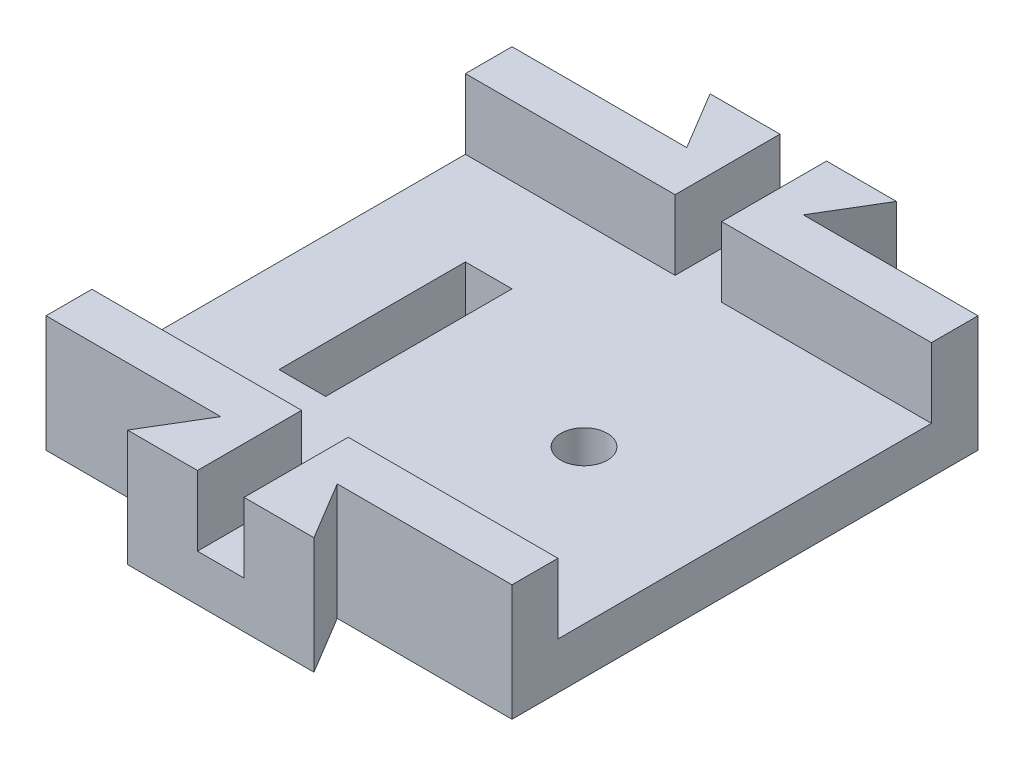
from build123d import *

# Parameters (mm, degrees)
SKETCH1_W           = 200
SKETCH1_H           = 200
SKETCH1_W_2         = 20
SKETCH1_H_2         = 80
BOSS_EXTRUDE1_DEPTH = 50
SHELL1_START        = 20.678946788
SHELL1_OUTLINE_W    = 30
SHELL1_OUTLINE_H    = 160
SHELL1_DEPTH        = 100
SHELL1_START_2      = -39.321053212
SHELL1_2_OUTLINE_W  = 30
SHELL1_2_OUTLINE_H  = 20
SHELL1_2_DEPTH      = 60
SKETCH4_W           = 60
SKETCH4_H           = 120
CUT_EXTRUDE1_DEPTH  = 30
BOSS_EXTRUDE2_DEPTH = 50
SKETCH6_W           = 20
SKETCH6_H           = 45
CUT_EXTRUDE2_DEPTH  = 30
SKETCH7_R           = 10
CUT_EXTRUDE3_DEPTH  = 28
SKETCH8_W           = 160.292931591
SKETCH8_H           = 30
CUT_EXTRUDE4_DEPTH  = 213


# Read off the part's stored shape, not the designer's step: Shell1
with BuildPart() as part:
    # Sketch1 → Boss-Extrude1 (new body)
    with BuildSketch(Plane(origin=(0, 0, 0), x_dir=(1, 0, 0), z_dir=(0, 1, 0))):
        with Locations((40.678946788, 74.932071062)):
            Rectangle(SKETCH1_W, SKETCH1_H)
        with Locations((-9.321053212, 74.932071062)):
            Rectangle(SKETCH1_W_2, SKETCH1_H_2, mode=Mode.SUBTRACT)
    extrude(amount=BOSS_EXTRUDE1_DEPTH)

    # Shell1 outline → Shell1 (cut)
    with BuildSketch(Plane.YZ.offset(SHELL1_START)):
        with Locations((35, -74.932071062)):
            Rectangle(SHELL1_OUTLINE_W, SHELL1_OUTLINE_H)
    extrude(amount=SHELL1_DEPTH, mode=Mode.SUBTRACT)

    # Shell1 2 outline → Shell1 2 (cut)
    with BuildSketch(Plane.YZ.offset(SHELL1_START_2)):
        with Locations((35, -144.932071062)):
            Rectangle(SHELL1_2_OUTLINE_W, SHELL1_2_OUTLINE_H)
        with Locations((35, -4.932071062)):
            Rectangle(SHELL1_2_OUTLINE_W, SHELL1_2_OUTLINE_H)
    extrude(amount=SHELL1_2_DEPTH, mode=Mode.SUBTRACT)

    # Sketch4 → Cut-Extrude1 (cut)
    with BuildSketch(Plane(origin=(0, 50, 0), x_dir=(1, 0, 0), z_dir=(0, 1, 0))):
        with Locations((-9.321053212, 74.932071062)):
            Rectangle(SKETCH4_W, SKETCH4_H)
    extrude(amount=-CUT_EXTRUDE1_DEPTH, mode=Mode.SUBTRACT)

    # Sketch5 → Boss-Extrude2 (add)
    with BuildSketch(Plane.XZ):
        Polygon((40.678946788, 25.067928938), (15.678946788, 25.067928938), (0.678946788, 50.067928938), (80.678946788, 50.067928938), (65.678946788, 25.067928938), align=None)
    boss_extrude2 = extrude(amount=-BOSS_EXTRUDE2_DEPTH)

    # Sketch6 → Cut-Extrude2 (cut)
    with BuildSketch(Plane(origin=(0, 50, 0), x_dir=(1, 0, 0), z_dir=(0, 1, 0))):
        with Locations((40.678946788, -27.567928938)):
            Rectangle(SKETCH6_W, SKETCH6_H)
    cut_extrude2 = extrude(amount=-CUT_EXTRUDE2_DEPTH, mode=Mode.SUBTRACT)

    # Mirror1: Boss-Extrude2, Cut-Extrude2 across plane
    add(boss_extrude2.mirror(Plane.XY.offset(-74.932071062)))
    add(cut_extrude2.mirror(Plane.XY.offset(-74.932071062)), mode=Mode.SUBTRACT)

    # Sketch7 → Cut-Extrude3 (cut)
    with BuildSketch(Plane(origin=(0, 0, 0), x_dir=(-1, 0, 0), z_dir=(0, -1, 0))):
        with Locations(Location((-74.835730419, 71.684680876, 0), (0, 0, 90))):
            Circle(SKETCH7_R)
    extrude(amount=-CUT_EXTRUDE3_DEPTH, mode=Mode.SUBTRACT)

    # Sketch8 → Cut-Extrude4 (cut)
    with BuildSketch(Plane(origin=(140.678946788, 0, 0), x_dir=(0, 0, -1), z_dir=(1, 0, 0))):
        with Locations((74.785605266, 35)):
            Rectangle(SKETCH8_W, SKETCH8_H)
    extrude(amount=-CUT_EXTRUDE4_DEPTH, mode=Mode.SUBTRACT)


solid = part.part
